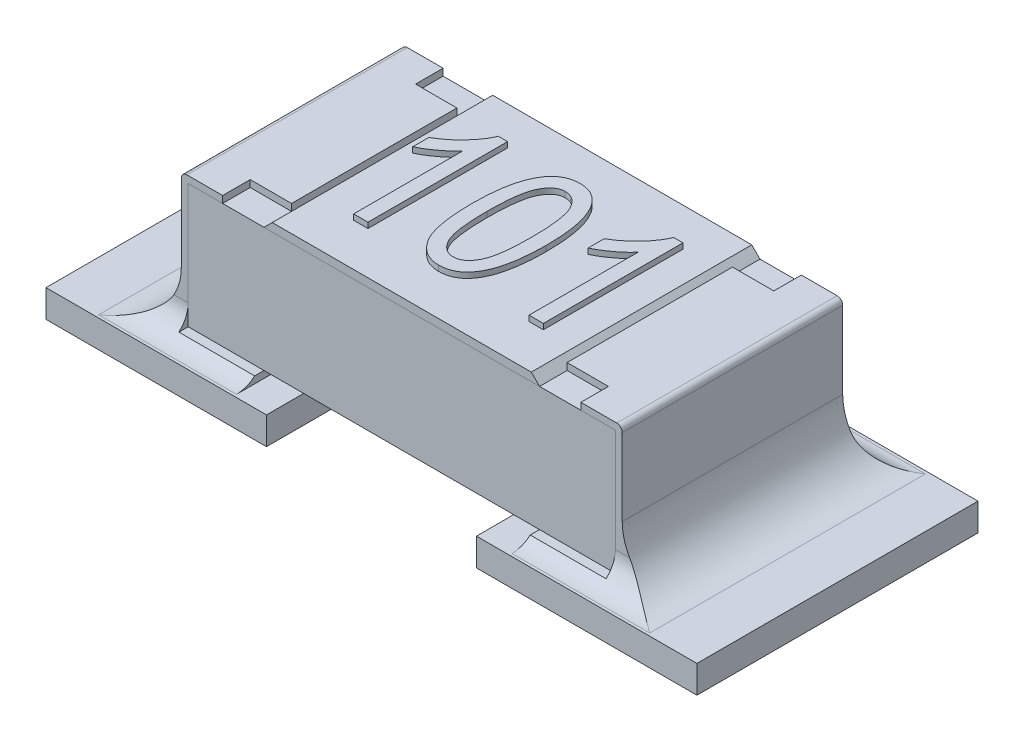
from build123d import *

# Parameters (mm, degrees)
SKETCH1_W             = 0.8
SKETCH1_H             = 0.45
BOSS_EXTRUDE1_DEPTH   = 0.775
BOSS_EXTRUDE2_DEPTH   = 0.4
BOSS_EXTRUDE2_2_DEPTH = 0.4
SKETCH3_W             = 0.15
SKETCH3_H             = 0.1
CUT_EXTRUDE1_DEPTH    = 0.025
BOSS_EXTRUDE3_DEPTH   = 0.4
SKETCH7_W             = 0.8
SKETCH7_H             = 1.02
BOSS_EXTRUDE5_DEPTH   = 0.1
FILLET3_R             = 0.2
FILLET4_R             = 0.2
FILLET5_R             = 0.1
FILLET6_R             = 0.1
BOSS_EXTRU_1_DEPTH    = 0.02


with BuildPart() as part:
    # Sketch1 → Boss-Extrude1 (new, symmetric)
    with BuildSketch(Plane(origin=(0, 0, 0), x_dir=(0, 0, -1), z_dir=(1, 0, 0))):
        with Locations((0, 0.35)):
            Rectangle(SKETCH1_W, SKETCH1_H)
    extrude(amount=BOSS_EXTRUDE1_DEPTH, both=True)


with BuildPart() as body_2:
    # Sketch2 → Boss-Extrude2 (new, symmetric)
    with BuildSketch(Plane.XY):
        with BuildLine():
            Line((-0.5, 0.6), (-0.78, 0.6))
            ThreePointArc((-0.78, 0.6), (-0.794142136, 0.594142136), (-0.8, 0.58))
            Line((-0.8, 0.58), (-0.8, 0.1))
            Line((-0.8, 0.1), (-0.5, 0.1))
            Line((-0.5, 0.1), (-0.5, 0.125))
            Line((-0.5, 0.125), (-0.775, 0.125))
            Line((-0.775, 0.125), (-0.775, 0.575))
            Line((-0.775, 0.575), (-0.5, 0.575))
            Line((-0.5, 0.575), (-0.5, 0.6))
        make_face()
    extrude(amount=BOSS_EXTRUDE2_DEPTH, both=True)


with BuildPart() as body_3:
    # Sketch2 → Boss-Extrude2 2 (new, symmetric)
    with BuildSketch(Plane.XY):
        with BuildLine():
            Line((0.5, 0.575), (0.5, 0.6))
            Line((0.5, 0.6), (0.78, 0.6))
            ThreePointArc((0.78, 0.6), (0.794142136, 0.594142136), (0.8, 0.58))
            Line((0.8, 0.58), (0.8, 0.1))
            Line((0.8, 0.1), (0.5, 0.1))
            Line((0.5, 0.1), (0.5, 0.125))
            Line((0.5, 0.125), (0.775, 0.125))
            Line((0.775, 0.125), (0.775, 0.575))
            Line((0.775, 0.575), (0.5, 0.575))
        make_face()
    extrude(amount=BOSS_EXTRUDE2_2_DEPTH, both=True)


with BuildPart() as cut_extrude1_tool:
    # Sketch3 → Cut-Extrude1 (new body)
    with BuildSketch(Plane(origin=(0, 0.6, 0), x_dir=(1, 0, 0), z_dir=(0, 1, 0))):
        with Locations((-0.575, 0.35)):
            Rectangle(SKETCH3_W, SKETCH3_H)
        with Locations((-0.575, -0.35)):
            Rectangle(SKETCH3_W, SKETCH3_H)
        with Locations((0.575, -0.35)):
            Rectangle(SKETCH3_W, SKETCH3_H)
        with Locations((0.575, 0.35)):
            Rectangle(SKETCH3_W, SKETCH3_H)
    extrude(amount=-CUT_EXTRUDE1_DEPTH)


with BuildPart() as body_2_1:
    add(body_2.part)

    # Cut-Extrude1: cut by cut_extrude1_tool
    add(cut_extrude1_tool.part, mode=Mode.SUBTRACT)



with BuildPart() as body_3_1:
    add(body_3.part)

    # Cut-Extrude1: cut by cut_extrude1_tool
    add(cut_extrude1_tool.part, mode=Mode.SUBTRACT)


with BuildPart() as body_4:
    # Sketch4 → Boss-Extrude3 (new, symmetric)
    with BuildSketch(Plane.XY):
        Polygon((-0.5, 0.575), (0.5, 0.575), (0.47, 0.605), (-0.47, 0.605), align=None)
    extrude(amount=BOSS_EXTRUDE3_DEPTH, both=True)

    # Esquisse2 → Boss.-Extru.1 (add)
    # profile 1 of 3: a face of its own
    with BuildSketch(Plane(origin=(0, 0.605, 0), x_dir=(1, 0, 0), z_dir=(0, 1, 0))):
        with BuildLine():
            Line((-0.277419159, -0.245221888), (-0.329367211, -0.245221888))
            Line((-0.329367211, -0.245221888), (-0.329367211, 0.150882009))
            add(Edge.make_bspline(
                [(-0.329367211, 0.150882009), (-0.33255753, 0.147209677), (-0.339169464, 0.139598774), (-0.350647442, 0.128775009), (-0.363438381, 0.1176135), (-0.377599648, 0.106782892), (-0.392028853, 0.096408923), (-0.406280373, 0.087284837), (-0.41982007, 0.079346193), (-0.428903295, 0.075031174), (-0.433263315, 0.072959931)],
                knots=[0, 0, 0, 0, 0.892555828, 1.849821039, 2.893015883, 4.008277588, 5.121255548, 6.154629642, 7.114207698, 8, 8, 8, 8], degree=3))
            Line((-0.433263315, 0.072959931), (-0.433263315, 0.131401489))
            add(Edge.make_bspline(
                [(-0.433263315, 0.131401489), (-0.426256411, 0.13561851), (-0.412302603, 0.144016443), (-0.392751491, 0.158564375), (-0.374281809, 0.174266475), (-0.35744561, 0.191287267), (-0.342370643, 0.208833156), (-0.329431452, 0.226343975), (-0.318822135, 0.243633673), (-0.313617925, 0.255526991), (-0.311104224, 0.261271619)],
                knots=[0, 0, 0, 0, 1.082272232, 2.155277244, 3.222407096, 4.289527553, 5.32168536, 6.282742408, 7.170542132, 8, 8, 8, 8], degree=3))
            Line((-0.311104224, 0.261271619), (-0.277419159, 0.261271619))
            Line((-0.277419159, 0.261271619), (-0.277419159, -0.245221888))
        make_face()
    # profile 2 of 3: a face of its own
    with BuildSketch(Plane(origin=(0, 0.605, 0), x_dir=(1, 0, 0), z_dir=(0, 1, 0))):
        with BuildLine():
            add(Edge.make_bspline(
                [(-0.147549029, 0.00457519), (-0.147466537, 0.01479126), (-0.147306358, 0.034628409), (-0.145650941, 0.063399949), (-0.143039858, 0.090278959), (-0.139489137, 0.115229398), (-0.134683655, 0.138255011), (-0.12902472, 0.15939274), (-0.122074419, 0.178575365), (-0.114251427, 0.195885139), (-0.105280253, 0.21122541), (-0.095389914, 0.224648892), (-0.084287025, 0.235937722), (-0.072277736, 0.245324824), (-0.059123137, 0.252476152), (-0.04501046, 0.257615666), (-0.029887534, 0.260717058), (-0.019452187, 0.261084261), (-0.014127763, 0.261271619)],
                knots=[0, 0, 0, 0, 1.522295809, 2.955932353, 4.292935845, 5.545987552, 6.709403679, 7.796379217, 8.803980711, 9.746667296, 10.623167879, 11.447716403, 12.224665142, 12.975696349, 13.710987297, 14.4460191, 15.207112772, 16, 16, 16, 16], degree=3))
            add(Edge.make_bspline(
                [(-0.014127763, 0.261271619), (-0.00938285, 0.261119405), (-6.4928e-05, 0.260820492), (0.013532278, 0.258355488), (0.026321328, 0.254161939), (0.038311883, 0.248334155), (0.04946752, 0.240809961), (0.059897997, 0.231712272), (0.069489012, 0.22085766), (0.075042737, 0.212703293), (0.0778974, 0.208511879)],
                knots=[0, 0, 0, 0, 1.02435884, 2.0116063, 2.972586715, 3.92329494, 4.881606269, 5.870473939, 6.905405214, 8, 8, 8, 8], degree=3))
            add(Edge.make_bspline(
                [(0.0778974, 0.208511879), (0.081201753, 0.202860902), (0.088073505, 0.191109101), (0.09627871, 0.171419216), (0.103194942, 0.149427268), (0.109026426, 0.125063264), (0.113186158, 0.098276968), (0.116478331, 0.069172575), (0.118383679, 0.037676929), (0.118581978, 0.015873733), (0.118684737, 0.00457519)],
                knots=[0, 0, 0, 0, 0.745747152, 1.550859881, 2.42529298, 3.372802996, 4.404287875, 5.514077945, 6.711780846, 8, 8, 8, 8], degree=3))
            add(Edge.make_bspline(
                [(0.118684737, 0.00457519), (0.118603246, -0.005573368), (0.118445039, -0.025275587), (0.116773055, -0.053910105), (0.114196761, -0.080658499), (0.110597814, -0.10553284), (0.105836898, -0.128501924), (0.100102772, -0.149633905), (0.093369381, -0.168919426), (0.085438101, -0.186231046), (0.076598991, -0.201660817), (0.066540873, -0.214948272), (0.055705564, -0.226438872), (0.043540388, -0.23562265), (0.030475546, -0.242976397), (0.016267757, -0.248029288), (0.001094421, -0.251174149), (-0.009377101, -0.25153216), (-0.014736529, -0.251715394)],
                knots=[0, 0, 0, 0, 1.513874866, 2.939007974, 4.277477108, 5.521918538, 6.686610019, 7.774777114, 8.786532326, 9.730252297, 10.61206932, 11.433487149, 12.211385775, 12.960169701, 13.698700869, 14.439280195, 15.201208188, 16, 16, 16, 16], degree=3))
            add(Edge.make_bspline(
                [(-0.014736529, -0.251715394), (-0.019516724, -0.251535975), (-0.028915126, -0.251183218), (-0.042705055, -0.248501144), (-0.05575647, -0.243876751), (-0.068138313, -0.237523555), (-0.079867046, -0.229401051), (-0.090799365, -0.219338145), (-0.101199397, -0.207599728), (-0.110942062, -0.19396939), (-0.119746041, -0.178096762), (-0.127188231, -0.159604049), (-0.133528749, -0.138579583), (-0.138560256, -0.114938484), (-0.142795274, -0.08877738), (-0.145456819, -0.059965056), (-0.147220924, -0.028557109), (-0.147436804, -0.006757381), (-0.147549029, 0.00457519)],
                knots=[0, 0, 0, 0, 0.713782411, 1.403376538, 2.088831486, 2.775699897, 3.476400496, 4.213162367, 4.989742879, 5.815463779, 6.710980744, 7.6941898, 8.787315853, 9.987366569, 11.302150399, 12.743876293, 14.307306722, 16, 16, 16, 16], degree=3))
        make_face()
        with BuildLine():
            add(Edge.make_bspline(
                [(-0.095600977, 0.004778112), (-0.095510395, -0.004962844), (-0.095337358, -0.023570963), (-0.094386416, -0.050273881), (-0.092589043, -0.074440086), (-0.090092676, -0.096145725), (-0.086927693, -0.115301137), (-0.083021376, -0.132011786), (-0.078366616, -0.146209724), (-0.072890289, -0.158097103), (-0.066817423, -0.167965156), (-0.060330818, -0.176373903), (-0.053623871, -0.183666527), (-0.046292266, -0.189491854), (-0.038680682, -0.194202042), (-0.030494994, -0.19727545), (-0.022023943, -0.199493814), (-0.016171753, -0.199675523), (-0.013214613, -0.199767342)],
                knots=[0, 0, 0, 0, 1.930873368, 3.688541263, 5.295281011, 6.732986767, 8.018032389, 9.141589856, 10.131594649, 10.974379403, 11.729767228, 12.422984227, 13.077418253, 13.687793181, 14.274134012, 14.843047171, 15.415386244, 16, 16, 16, 16], degree=3))
            add(Edge.make_bspline(
                [(-0.013214613, -0.199767342), (-0.010427064, -0.19967107), (-0.004876608, -0.199479377), (0.003214206, -0.197283662), (0.011014124, -0.194062792), (0.018392056, -0.189401372), (0.025337409, -0.183405877), (0.031944313, -0.176126804), (0.038222607, -0.167556151), (0.044243115, -0.157540122), (0.049661257, -0.145592351), (0.054269802, -0.131326946), (0.058147641, -0.114621658), (0.061355308, -0.095476215), (0.063679163, -0.073856395), (0.065539644, -0.049836144), (0.066465897, -0.023333722), (0.066643834, -0.004861208), (0.066736685, 0.004778112)],
                knots=[0, 0, 0, 0, 0.556098029, 1.107279675, 1.665020537, 2.239289732, 2.843790749, 3.494855459, 4.20099618, 4.965402842, 5.827994078, 6.818278647, 7.958442113, 9.254955883, 10.697998423, 12.305588537, 14.072183745, 16, 16, 16, 16], degree=3))
            add(Edge.make_bspline(
                [(0.066736685, 0.004778112), (0.066644247, 0.014518953), (0.066467022, 0.033194439), (0.065536544, 0.059932684), (0.063706558, 0.084163121), (0.061254358, 0.105841815), (0.058028708, 0.125018143), (0.054199757, 0.141717126), (0.049468888, 0.155886496), (0.044070333, 0.167750164), (0.037873861, 0.177530431), (0.031547138, 0.186066808), (0.024613966, 0.193179002), (0.017326453, 0.199101273), (0.009578464, 0.203716122), (0.001336, 0.207013805), (-0.007336855, 0.208998194), (-0.013272092, 0.209214654), (-0.016258444, 0.209323567)],
                knots=[0, 0, 0, 0, 1.926173374, 3.692928135, 5.28908838, 6.72993665, 8.005261178, 9.132588719, 10.113846285, 10.954579593, 11.702439438, 12.399284011, 13.051919516, 13.660808713, 14.251466784, 14.827675714, 15.41013748, 16, 16, 16, 16], degree=3))
            add(Edge.make_bspline(
                [(-0.016258444, 0.209323567), (-0.019046448, 0.209229838), (-0.024564948, 0.209044314), (-0.032588492, 0.206839344), (-0.040285896, 0.203615308), (-0.047609781, 0.198933153), (-0.054467733, 0.192853165), (-0.061128216, 0.185619176), (-0.067268818, 0.176971227), (-0.073311403, 0.16704689), (-0.078634531, 0.155067165), (-0.083250225, 0.140826575), (-0.086962575, 0.124091318), (-0.090243034, 0.105003485), (-0.092537193, 0.083411294), (-0.094405868, 0.059392779), (-0.095329633, 0.03288983), (-0.095507935, 0.014417392), (-0.095600977, 0.004778112)],
                knots=[0, 0, 0, 0, 0.557102101, 1.102712893, 1.655222221, 2.224793741, 2.834805151, 3.487045402, 4.190458401, 4.956245252, 5.811421647, 6.809929224, 7.950602775, 9.242777249, 10.688425301, 12.298918027, 14.068702942, 16, 16, 16, 16], degree=3))
        make_face(mode=Mode.SUBTRACT)
    # profile 3 of 3: a face of its own
    with BuildSketch(Plane(origin=(0, 0.605, 0), x_dir=(1, 0, 0), z_dir=(0, 1, 0))):
        with BuildLine():
            Line((0.358944478, -0.245221888), (0.306996426, -0.245221888))
            Line((0.306996426, -0.245221888), (0.306996426, 0.150882009))
            add(Edge.make_bspline(
                [(0.306996426, 0.150882009), (0.303806106, 0.147209677), (0.297194172, 0.139598774), (0.285716194, 0.128775009), (0.272925255, 0.1176135), (0.258763988, 0.106782892), (0.244334784, 0.096408923), (0.230083263, 0.087284837), (0.216543567, 0.079346193), (0.207460341, 0.075031174), (0.203100322, 0.072959931)],
                knots=[0, 0, 0, 0, 0.892555828, 1.849821039, 2.893015883, 4.008277588, 5.121255548, 6.154629642, 7.114207698, 8, 8, 8, 8], degree=3))
            Line((0.203100322, 0.072959931), (0.203100322, 0.131401489))
            add(Edge.make_bspline(
                [(0.203100322, 0.131401489), (0.210107225, 0.13561851), (0.224061033, 0.144016443), (0.243612145, 0.158564375), (0.262081827, 0.174266475), (0.278918027, 0.191287267), (0.293992994, 0.208833156), (0.306932185, 0.226343975), (0.317541502, 0.243633673), (0.322745711, 0.255526991), (0.325259413, 0.261271619)],
                knots=[0, 0, 0, 0, 1.082272232, 2.155277244, 3.222407096, 4.289527553, 5.32168536, 6.282742408, 7.170542132, 8, 8, 8, 8], degree=3))
            Line((0.325259413, 0.261271619), (0.358944478, 0.261271619))
            Line((0.358944478, 0.261271619), (0.358944478, -0.245221888))
        make_face()
    extrude(amount=BOSS_EXTRU_1_DEPTH)


with BuildPart() as body_2_2:
    add(body_2_1.part)

    add(body_3_1.part)  # Boss-Extrude5 merges body 3
    # Sketch7 → Boss-Extrude5 (add)
    with BuildSketch(Plane(origin=(0, 0, 0), x_dir=(1, 0, 0), z_dir=(0, 1, 0))):
        with Locations((-0.781, 0)):
            Rectangle(SKETCH7_W, SKETCH7_H)
        with Locations((0.781, 0)):
            Rectangle(SKETCH7_W, SKETCH7_H)
    extrude(amount=BOSS_EXTRUDE5_DEPTH)

    # Fillet3
    fillet3_edges = [body_2_2.edges().sort_by_distance(p)[0] for p in [
        (-0.8, 0.1, 0),
    ]]
    fillet(fillet3_edges, radius=FILLET3_R)

    # Fillet4
    fillet4_edges = [body_2_2.edges().sort_by_distance(p)[0] for p in [
        (0.8, 0.1, 0),
    ]]
    fillet(fillet4_edges, radius=FILLET4_R)

    # Fillet5
    fillet5_edges = [body_2_2.edges().sort_by_distance(p)[0] for p in [
        (0.75, 0.1, 0.4),
    ]]
    fillet(fillet5_edges, radius=FILLET5_R)
    fillet5_2_edges = [body_2_2.edges().sort_by_distance(p)[0] for p in [
        (0.75, 0.1, -0.4),
    ]]
    fillet(fillet5_2_edges, radius=FILLET5_R)

    # Fillet6
    fillet6_edges = [body_2_2.edges().sort_by_distance(p)[0] for p in [
        (-0.75, 0.1, -0.4),
    ]]
    fillet(fillet6_edges, radius=FILLET6_R)
    fillet6_2_edges = [body_2_2.edges().sort_by_distance(p)[0] for p in [
        (-0.75, 0.1, 0.4),
    ]]
    fillet(fillet6_2_edges, radius=FILLET6_R)


solid = Compound([part.part, body_4.part, body_2_2.part])
